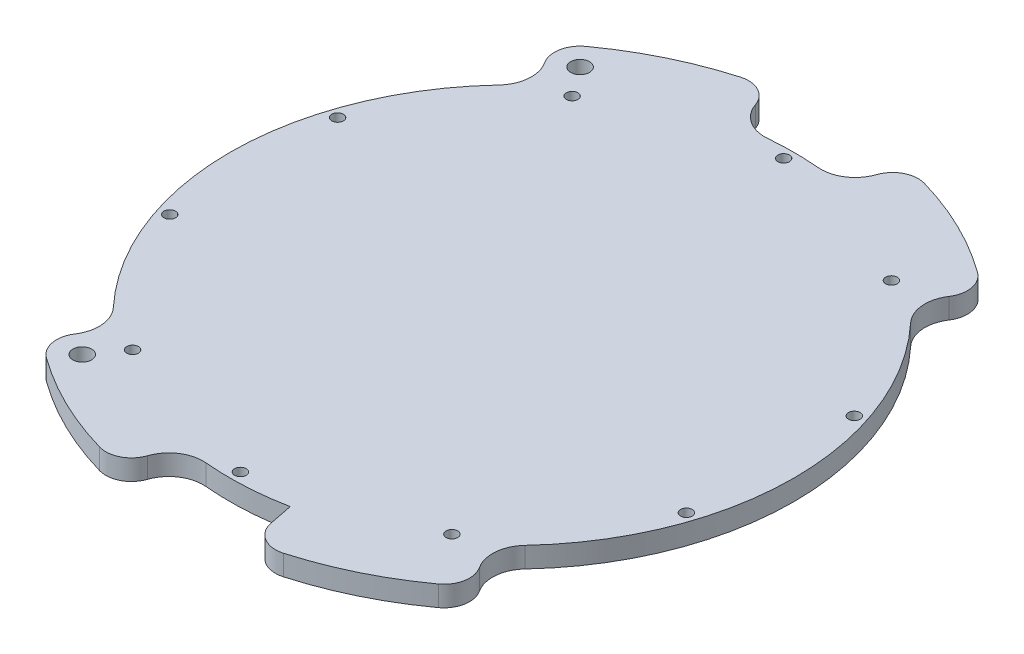
from build123d import *

# Parameters (mm, degrees)
SKETCH1_R            = 2.75
BOSS_EXTRUDE1_DEPTH  = 3
M3_CLEARANCE_HOLE1_D = 3.4
FILLET2_R            = 10


with BuildPart() as part:
    # Sketch1 → Boss-Extrude1 (new, symmetric)
    with BuildSketch(Plane(origin=(0, 0, 0), x_dir=(1, 0, 0), z_dir=(0, 1, 0))):
        with BuildLine():
            Line((-58.614111744, 67.959966353), (-53.914904373, 62.511483636))
            ThreePointArc((-53.914904373, 62.511483636), (-82.55, 0), (-53.914904373, -62.511483636))
            Line((-53.914904373, -62.511483636), (-58.614111744, -67.959966353))
            ThreePointArc((-58.614111744, -67.959966353), (-60.384815089, -73.721869234), (-57.34308106, -78.925980035))
            ThreePointArc((-57.34308106, -78.925980035), (-42.766558206, -87.684438581), (-26.890595122, -93.77864983))
            ThreePointArc((-26.890595122, -93.77864983), (-20.917021387, -92.971598421), (-17.46673379, -88.028883515))
            Line((-17.46673379, -88.028883515), (-16.066391761, -80.971436666))
            ThreePointArc((-16.066391761, -80.971436666), (0, -82.55), (16.066391761, -80.971436666))
            Line((16.066391761, -80.971436666), (17.46673379, -88.028883515))
            ThreePointArc((17.46673379, -88.028883515), (20.917021387, -92.971598421), (26.890595122, -93.77864983))
            ThreePointArc((26.890595122, -93.77864983), (42.766558206, -87.684438581), (57.34308106, -78.925980035))
            ThreePointArc((57.34308106, -78.925980035), (60.384815089, -73.721869234), (58.614111744, -67.959966353))
            Line((58.614111744, -67.959966353), (53.914904373, -62.511483636))
            ThreePointArc((53.914904373, -62.511483636), (82.55, 0), (53.914904373, 62.511483636))
            Line((53.914904373, 62.511483636), (58.614111744, 67.959966353))
            ThreePointArc((58.614111744, 67.959966353), (60.384815089, 73.721869234), (57.34308106, 78.925980035))
            ThreePointArc((57.34308106, 78.925980035), (42.766558206, 87.684438581), (26.890595122, 93.77864983))
            ThreePointArc((26.890595122, 93.77864983), (20.917021387, 92.971598421), (17.46673379, 88.028883515))
            Line((17.46673379, 88.028883515), (16.066391761, 80.971436666))
            ThreePointArc((16.066391761, 80.971436666), (0, 82.55), (-16.066391761, 80.971436666))
            Line((-16.066391761, 80.971436666), (-17.46673379, 88.028883515))
            ThreePointArc((-17.46673379, 88.028883515), (-20.917021387, 92.971598421), (-26.890595122, 93.77864983))
            ThreePointArc((-26.890595122, 93.77864983), (-42.766558206, 87.684438581), (-57.34308106, 78.925980035))
            ThreePointArc((-57.34308106, 78.925980035), (-60.384815089, 73.721869234), (-58.614111744, 67.959966353))
        make_face()
        with Locations((-52.934691668, 72.858352577)):
            Circle(SKETCH1_R, mode=Mode.SUBTRACT)
        with Locations((-52.934691668, -72.858352577)):
            Circle(SKETCH1_R, mode=Mode.SUBTRACT)
    extrude(amount=BOSS_EXTRUDE1_DEPTH, both=True)

    # M3 Clearance Hole1 (through all)
    with Locations(Plane(origin=(0, 3, 0), x_dir=(1, 0, 0), z_dir=(0, 1, 0))):
        with Locations((0, 79.5), (46.728927557, 64.316851053), (75.608993045, 24.566851053), (75.608993045, -24.566851053), (46.728927557, -64.316851053), (0, -79.5), (-46.728927557, -64.316851053), (-75.608993045, -24.566851053), (-75.608993045, 24.566851053), (-46.728927557, 64.316851053)):
            Hole(M3_CLEARANCE_HOLE1_D / 2)

    # Fillet2
    fillet2_edges = [part.edges().sort_by_distance(p)[0] for p in [
        (-53.914904373, 0, 62.511483636),
        (-53.914904373, 0, -62.511483636),
        (-16.066391761, 0, 80.971436666),
        (53.914904373, 0, 62.511483636),
        (53.914904373, 0, -62.511483636),
        (16.066391761, 0, -80.971436666),
        (-16.066391761, 0, -80.971436666),
    ]]
    fillet(fillet2_edges, radius=FILLET2_R)


solid = part.part
